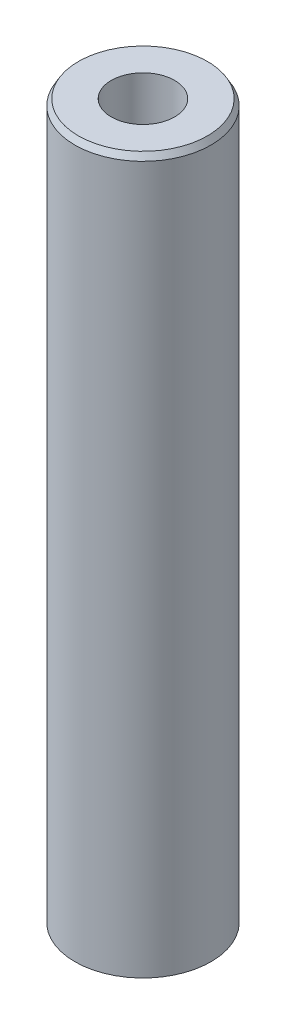
from build123d import *
from OCP.BRepFilletAPI import BRepFilletAPI_MakeChamfer

# Parameters (mm, degrees)
SKETCH1_R           = 10
BOSS_EXTRUDE1_DEPTH = 105.335694949
SKETCH2_R           = 4.656049896
CUT_EXTRUDE1_DEPTH  = 107.280800855
CHAMFER1_SIZE       = 0.906328163
CHAMFER1_SIZE2      = 0.523268809


with BuildPart() as part:
    # Sketch1 → Boss-Extrude1 (new body)
    with BuildSketch(Plane(origin=(0, 0, 0), x_dir=(1, 0, 0), z_dir=(0, 1, 0))):
        Circle(SKETCH1_R)
    extrude(amount=BOSS_EXTRUDE1_DEPTH)

    # Sketch2 → Cut-Extrude1 (cut, through all)
    with BuildSketch(Plane(origin=(0, 0, 0), x_dir=(1, 0, 0), z_dir=(0, 1, 0))):
        Circle(SKETCH2_R)
    extrude(amount=CUT_EXTRUDE1_DEPTH, mode=Mode.SUBTRACT)

    # Chamfer1: one chamfer whose edges measure the first distance from different faces: ONE call of the kernel's chamfer builder (chamfer() names one face for all edges)
    chamfer1_edges_1 = [part.edges().sort_by_distance(p)[0] for p in [
        (-10, 105.335694949, 0),
    ]]
    chamfer1_side_1 = [part.faces().sort_by_distance(p)[0] for p in [
        (-10, 52.667847474, 0),
    ]]
    chamfer1_edges_2 = [part.edges().sort_by_distance(p)[0] for p in [
        (-10, 0, 0),
    ]]
    chamfer1_side_2 = [part.faces().sort_by_distance(p)[0] for p in [
        (-9.717157288, 0, 0),
    ]]
    chamfer1 = BRepFilletAPI_MakeChamfer(part.part.solid().wrapped)
    for e in chamfer1_edges_1:
        chamfer1.Add(CHAMFER1_SIZE, CHAMFER1_SIZE2, e.wrapped, chamfer1_side_1[0].wrapped)  # the first distance lies on this face
    for e in chamfer1_edges_2:
        chamfer1.Add(CHAMFER1_SIZE, CHAMFER1_SIZE2, e.wrapped, chamfer1_side_2[0].wrapped)  # the first distance lies on this face
    add(Compound.cast(chamfer1.Shape()), mode=Mode.REPLACE)


solid = part.part
